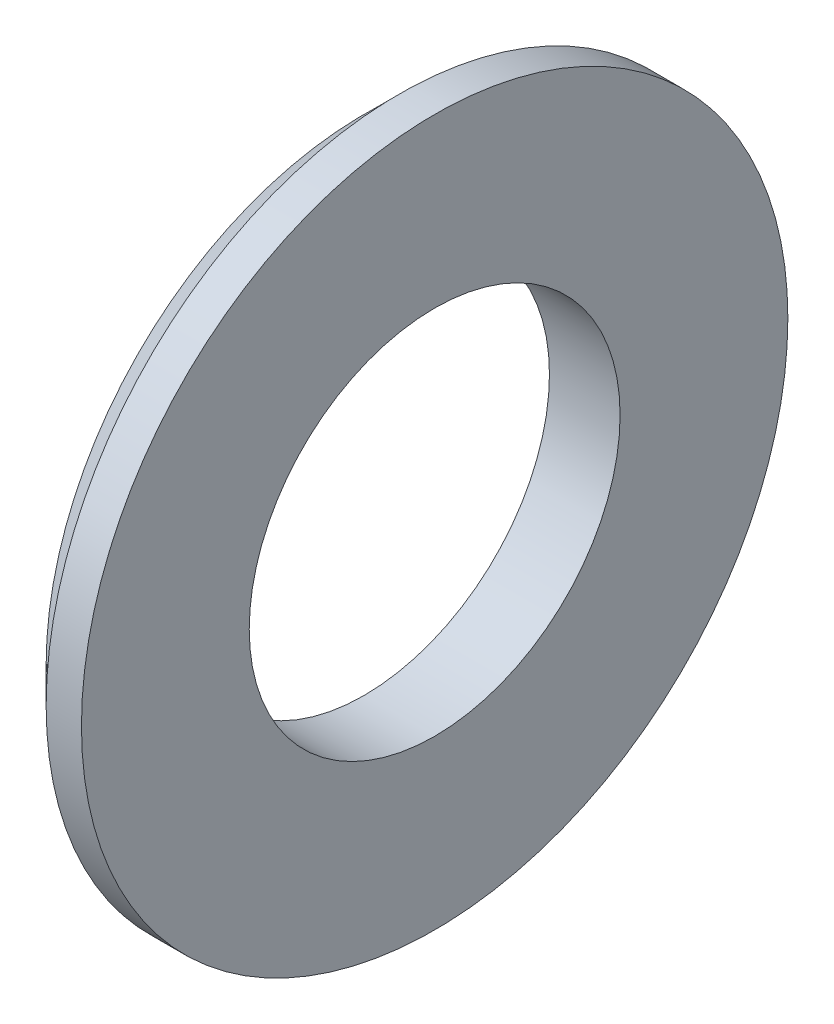
from build123d import *


with BuildPart() as part:
    # Sketch1 → Base-Revolve (revolve)
    with BuildSketch(Plane.XY):
        Polygon((0, 5.25), (0, 10), (-1, 10), (-2, 9), (-2, 5.25), align=None)
    revolve(axis=Axis((-34.925, 0, 0), (1, 0, 0)))


solid = part.part
